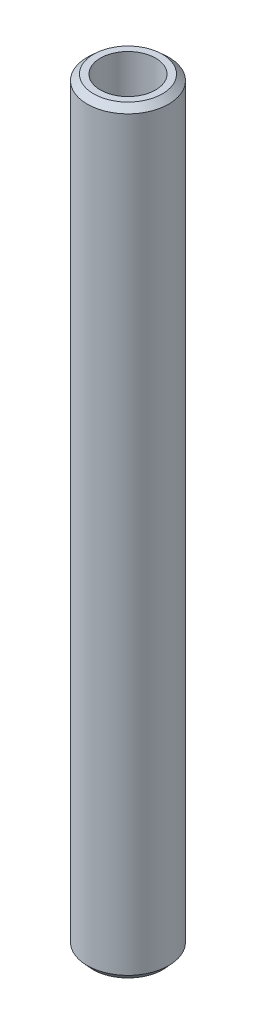
from build123d import *
from OCP.BRepFilletAPI import BRepFilletAPI_MakeChamfer

# Parameters (mm, degrees)
SKETCH1_R           = 15
BOSS_EXTRUDE1_DEPTH = 279.537881716
SKETCH2_R           = 10.185054047
CUT_EXTRUDE1_DEPTH  = 281.341626082
CHAMFER1_SIZE       = 2.112112229
CHAMFER1_SIZE2      = 2.334598116


with BuildPart() as part:
    # Sketch1 → Boss-Extrude1 (new body)
    with BuildSketch(Plane(origin=(0, 0, 0), x_dir=(1, 0, 0), z_dir=(0, 1, 0))):
        Circle(SKETCH1_R)
    extrude(amount=BOSS_EXTRUDE1_DEPTH)

    # Sketch2 → Cut-Extrude1 (cut, through all)
    with BuildSketch(Plane(origin=(0, 0, 0), x_dir=(1, 0, 0), z_dir=(0, 1, 0))):
        Circle(SKETCH2_R)
    extrude(amount=CUT_EXTRUDE1_DEPTH, mode=Mode.SUBTRACT)

    # Chamfer1: one chamfer whose edges measure the first distance from different faces: ONE call of the kernel's chamfer builder (chamfer() names one face for all edges)
    chamfer1_edges_1 = [part.edges().sort_by_distance(p)[0] for p in [
        (-15, 279.537881716, 0),
    ]]
    chamfer1_side_1 = [part.faces().sort_by_distance(p)[0] for p in [
        (-15, 139.768940858, 0),
    ]]
    chamfer1_edges_2 = [part.edges().sort_by_distance(p)[0] for p in [
        (-15, 0, 0),
    ]]
    chamfer1_side_2 = [part.faces().sort_by_distance(p)[0] for p in [
        (-14.575735931, 0, 0),
    ]]
    chamfer1 = BRepFilletAPI_MakeChamfer(part.part.solid().wrapped)
    for e in chamfer1_edges_1:
        chamfer1.Add(CHAMFER1_SIZE, CHAMFER1_SIZE2, e.wrapped, chamfer1_side_1[0].wrapped)  # the first distance lies on this face
    for e in chamfer1_edges_2:
        chamfer1.Add(CHAMFER1_SIZE, CHAMFER1_SIZE2, e.wrapped, chamfer1_side_2[0].wrapped)  # the first distance lies on this face
    add(Compound.cast(chamfer1.Shape()), mode=Mode.REPLACE)


solid = part.part
